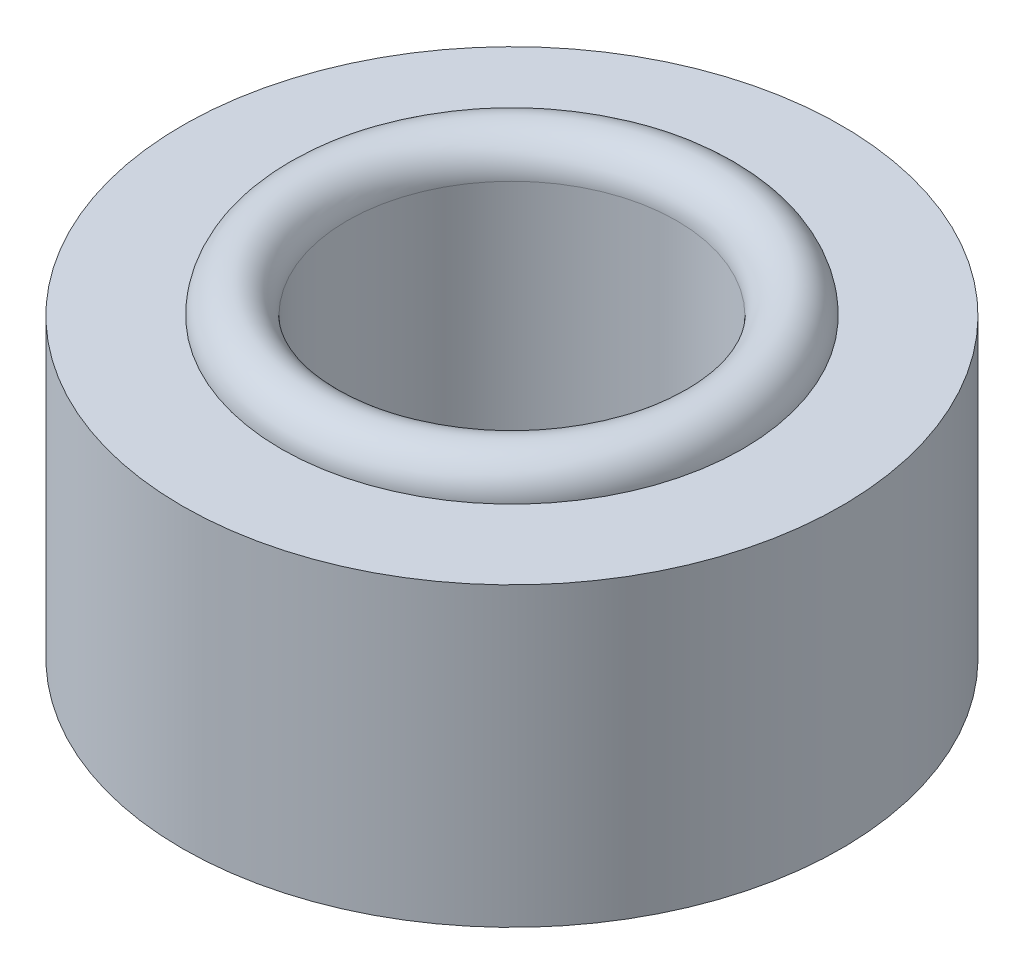
from build123d import *

# Parameters (mm, degrees)
PROFILE_SKETCH_R              = 10
PROFILE_SKETCH_R_2            = 5
CYLINDER_EXTRUDE_DEPTH        = 9
LIP_RING_SKETCH_R             = 7
LIP_RING_SKETCH_R_2           = 5
BOTTOM_LIP_RING_EXTRUDE_DEPTH = 1
BOTTOM_RING_FILLET_R          = 1
TOP_START                     = -10
SKETCH2_2_R                   = 7
SKETCH2_2_R_2                 = 5
TOP_LIP_RING_EXTRUDE_DEPTH    = 1
TOP_RING_FILLET_R             = 1


with BuildPart() as part:
    # Profile Sketch → Cylinder Extrude (new body)
    with BuildSketch(Plane(origin=(0, 0, 0), x_dir=(1, 0, 0), z_dir=(0, 1, 0))):
        with Locations(Location((0, 0, 0), (0, 0, 270))):
            Circle(PROFILE_SKETCH_R)
        with Locations(Location((0, 0, 0), (0, 0, 270))):
            Circle(PROFILE_SKETCH_R_2, mode=Mode.SUBTRACT)
    extrude(amount=CYLINDER_EXTRUDE_DEPTH)

    # Lip Ring Sketch → Bottom Lip Ring Extrude (add)
    with BuildSketch(Plane(origin=(0, 9, 0), x_dir=(1, 0, 0), z_dir=(0, 1, 0))):
        with Locations(Location((0, 0, 0), (0, 0, 270))):
            Circle(LIP_RING_SKETCH_R)
        with Locations(Location((0, 0, 0), (0, 0, 270))):
            Circle(LIP_RING_SKETCH_R_2, mode=Mode.SUBTRACT)
    extrude(amount=BOTTOM_LIP_RING_EXTRUDE_DEPTH)

    # Bottom Ring Fillet
    bottom_ring_fillet_edges = [part.edges().sort_by_distance(p)[0] for p in [
        (0, 10, -7),
        (0, 10, -5),
    ]]
    fillet(bottom_ring_fillet_edges, radius=BOTTOM_RING_FILLET_R - 0.0001)  # a hair under: the kernel refuses the full size

    # Sketch2<2> → Top Lip Ring Extrude (add)
    with BuildSketch(Plane(origin=(0, 9, 0), x_dir=(1, 0, 0), z_dir=(0, 1, 0)).offset(TOP_START)):
        with Locations(Location((0, 0, 0), (0, 0, 270))):
            Circle(SKETCH2_2_R)
        with Locations(Location((0, 0, 0), (0, 0, 270))):
            Circle(SKETCH2_2_R_2, mode=Mode.SUBTRACT)
    extrude(amount=TOP_LIP_RING_EXTRUDE_DEPTH)

    # Top Ring Fillet
    top_ring_fillet_edges = [part.edges().sort_by_distance(p)[0] for p in [
        (0, -1, -7),
        (0, -1, -5),
    ]]
    fillet(top_ring_fillet_edges, radius=TOP_RING_FILLET_R - 0.0001)  # a hair under: the kernel refuses the full size


solid = part.part
